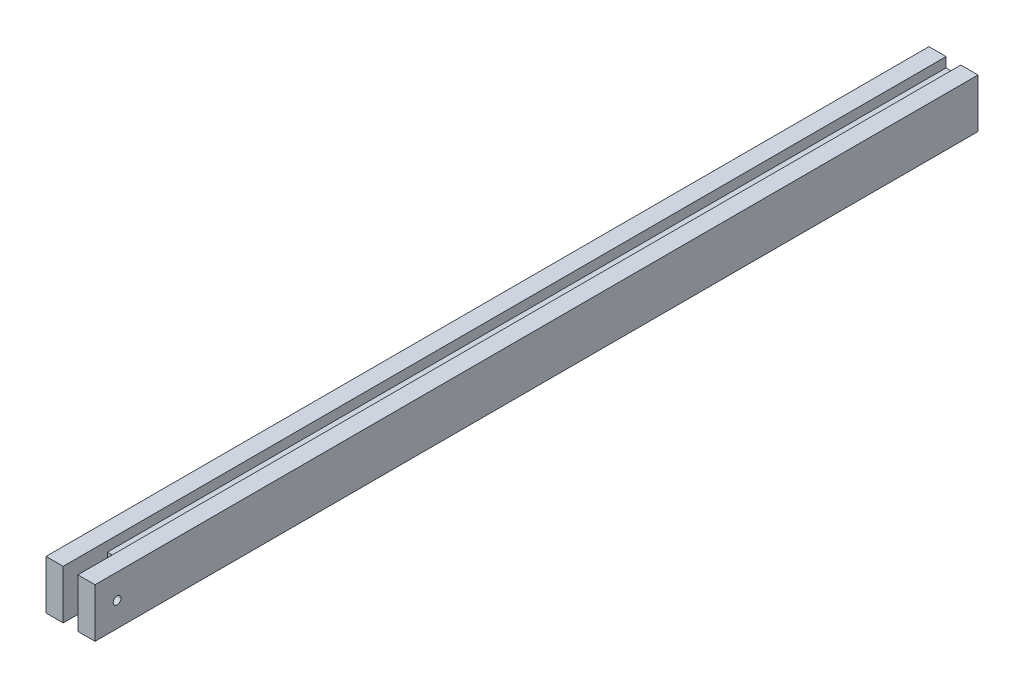
from build123d import *

# Parameters (mm, degrees)
ESQUISSE1_W             = 100
ESQUISSE1_H             = 100
BOSS_EXTRU_1_DEPTH      = 1800
ESQUISSE2_W             = 30
ESQUISSE2_H             = 90
ENL_V_MAT_EXTRU_1_DEPTH = 1806.547008527
ESQUISSE3_R             = 8
ENL_V_MAT_EXTRU_2_DEPTH = 1806.547008527
ESQUISSE4_W             = 30
ESQUISSE4_H             = 20
ENL_V_MAT_EXTRU_3_DEPTH = 1806.547008527


with BuildPart() as part:
    # Esquisse1 → Boss.-Extru.1 (new body)
    with BuildSketch(Plane.XY):
        with Locations((50, 50)):
            Rectangle(ESQUISSE1_W, ESQUISSE1_H)
    extrude(amount=BOSS_EXTRU_1_DEPTH)

    # Esquisse2 → Enlèv. mat.-Extru.1 (cut, through all)
    with BuildSketch(Plane.XZ):
        with Locations((50, 1755)):
            Rectangle(ESQUISSE2_W, ESQUISSE2_H)
    extrude(amount=-ENL_V_MAT_EXTRU_1_DEPTH, mode=Mode.SUBTRACT)

    # Esquisse3 → Enlèv. mat.-Extru.2 (cut, through all)
    with BuildSketch(Plane(origin=(100, 0, 0), x_dir=(0, 0, -1), z_dir=(1, 0, 0))):
        with Locations((-1755, 50)):
            Circle(ESQUISSE3_R)
    extrude(amount=-ENL_V_MAT_EXTRU_2_DEPTH, mode=Mode.SUBTRACT)

    # Esquisse4 → Enlèv. mat.-Extru.3 (cut, through all)
    with BuildSketch(Plane(origin=(0, 0, 0), x_dir=(-1, 0, 0), z_dir=(0, 0, -1))):
        with Locations((-50, 90)):
            Rectangle(ESQUISSE4_W, ESQUISSE4_H)
        with Locations((-50, 10)):
            Rectangle(ESQUISSE4_W, ESQUISSE4_H)
    extrude(amount=-ENL_V_MAT_EXTRU_3_DEPTH, mode=Mode.SUBTRACT)


solid = part.part
